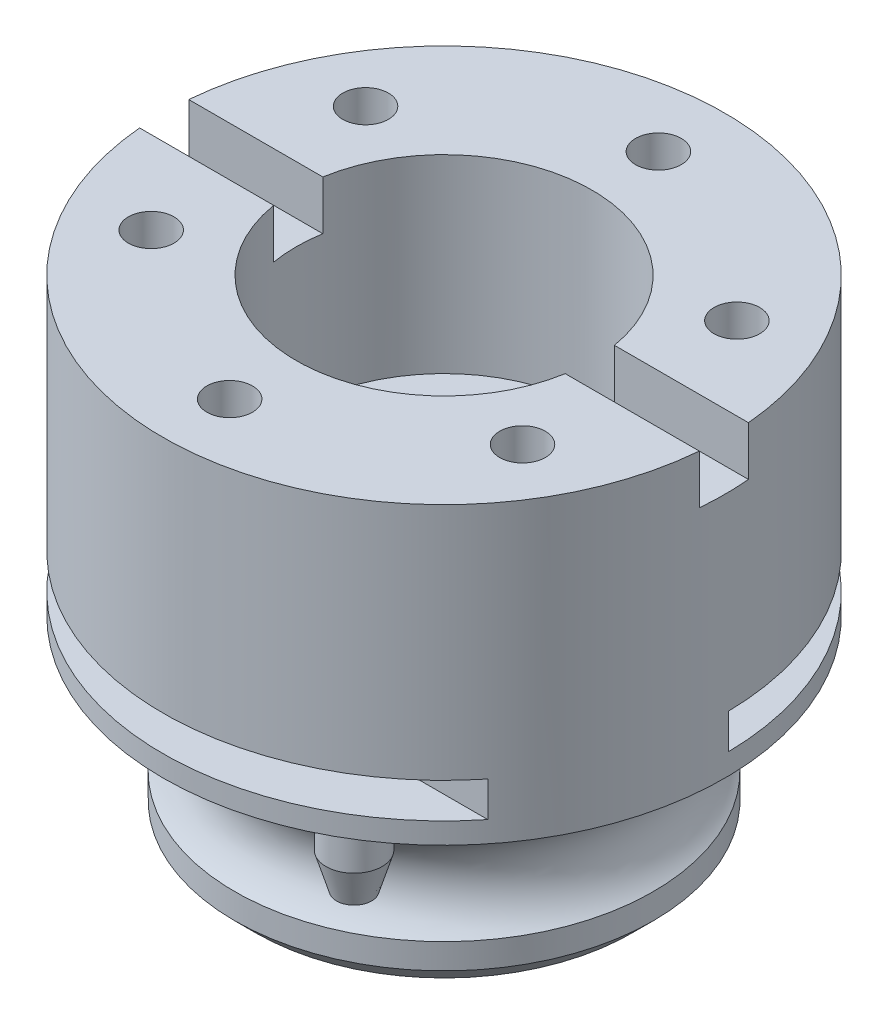
from build123d import *

# Parameters (mm, degrees)
SKETCH1_R                            = 29.8
SKETCH1_R_2                          = 20.2
BOSS_EXTRUDE1_DEPTH                  = 25.7
SKETCH3_R                            = 40
BOSS_EXTRUDE2_DEPTH                  = 15
SKETCH4_R                            = 4
BOSS_EXTRUDE3_DEPTH                  = 5
SKETCH6_R                            = 2.5
CUT_EXTRUDE1_START                   = -12
CUT_EXTRUDE1_DEPTH                   = 5
CUT_EXTRUDE6_DEPTH                   = 3.2
SKETCH15_W                           = 16.44
SKETCH15_H                           = 4.4
CUT_EXTRUDE7_DEPTH                   = 63.132841557
SKETCH16_R                           = 0.8
CUT_EXTRUDE8_DEPTH                   = 64.523302811
CUT_EXTRUDE15_START                  = 40
SKETCH25_R                           = 3.2
CUT_EXTRUDE15_DEPTH                  = 3.5
SKETCH20_R                           = 40
SKETCH20_R_2                         = 21.05
BOSS_EXTRUDE4_DEPTH                  = 27
SKETCH29_R                           = 3.25
BASEPLATE_MOUNTING_HOLES_DEPTH       = 4.825
CUT_EXTRUDE17_REACH                  = 90.223
CUT_EXTRUDE17_END_RADIUS             = 40
SKETCH28_W                           = 7
SKETCH28_H                           = 7
CUT_EXTRUDE17_DIRECTION_2_REACH      = 90.223
CUT_EXTRUDE17_DIRECTION_2_END_RADIUS = 40


with BuildPart() as part:
    # Sketch1 → Boss-Extrude1 (new body)
    with BuildSketch(Plane(origin=(0, 0, 0), x_dir=(1, 0, 0), z_dir=(0, 1, 0))):
        with Locations(Location((0, 0, 0), (0, 0, 90))):
            Circle(SKETCH1_R)
        with Locations(Location((0, 0, 0), (0, 0, 90))):
            Circle(SKETCH1_R_2, mode=Mode.SUBTRACT)
    extrude(amount=BOSS_EXTRUDE1_DEPTH)

    # Sketch2 → Cut-Revolve1 (revolve, cut)
    with BuildSketch(Plane.XY, mode=Mode.PRIVATE) as cut_revolve1_sk:
        with BuildLine():
            Line((29.8, 12.7), (29.8, 18.799180273))
            ThreePointArc((29.8, 18.799180273), (27.590586132, 16.098529094), (26.8, 12.7))
            Line((26.8, 12.7), (29.8, 12.7))
        make_face()
        with BuildLine():
            Line((29.8, 6.600819727), (29.8, 12.7))
            Line((29.8, 12.7), (26.8, 12.7))
            ThreePointArc((26.8, 12.7), (27.590586132, 9.301470906), (29.8, 6.600819727))
        make_face()
        Polygon((29.8, 3), (26.8, 0), (29.8, 0), align=None)
    revolve(cut_revolve1_sk.sketch.rotate(Axis((0, 25.7, 0), (0, -1, 0)), 270), axis=Axis((0, 25.7, 0), (0, -1, 0)), mode=Mode.SUBTRACT)

    # Sketch3 → Boss-Extrude2 (add)
    with BuildSketch(Plane(origin=(0, 25.7, 0), x_dir=(1, 0, 0), z_dir=(0, 1, 0))):
        with Locations(Location((0, 0, 0), (0, 0, 270))):
            Circle(SKETCH3_R)
    extrude(amount=BOSS_EXTRUDE2_DEPTH)

    # Sketch4 → Boss-Extrude3 (add)
    with BuildSketch(Plane(origin=(0, 25.7, 0), x_dir=(-1, 0, 0), z_dir=(0, -1, 0))):
        with Locations(Location((-17.5, -30.310889132, 0), (0, 0, 270))):
            Circle(SKETCH4_R)
        with Locations(Location((32.889241728, -11.970705016, 0), (0, 0, 270))):
            Circle(SKETCH4_R)
        with Locations(Location((-6.077686218, 34.468271355, 0), (0, 0, 270))):
            Circle(SKETCH4_R)
    extrude(amount=BOSS_EXTRUDE3_DEPTH)

    # Sketch6 → section 1 of loft1
    with BuildSketch(Plane(origin=(0, 15.7, 0), x_dir=(-1, 0, 0), z_dir=(0, -1, 0)), mode=Mode.PRIVATE) as loft1_s1:
        with Locations((32.889241728, -11.970705016)):
            Circle(SKETCH6_R)
    # loft from a face of the part (loft1)
    loft([part.faces().sort_by_distance((-32.889241728, 20.7, 11.970705016))[0], loft1_s1.sketch])

    # Boundary1: read off the stored shape, not the designer's step
    # Boundary1 outline → Boundary1 (revolve)
    with BuildSketch(Plane(origin=(17.5, 0, 30.310889132), x_dir=(1, 0, 0), z_dir=(0, 0, 1))):
        Polygon((0, 20.7), (0, 15.7), (2.5, 15.7), (4, 20.7), align=None)
    revolve(axis=Axis((17.5, 0, 30.310889132), (0, 1, 0)))

    # Boundary2: read off the stored shape, not the designer's step
    # Boundary2: loft between two sections, ruled curve by curve
    boundary2_from = [
        Edge.make_bspline([(9.922742778, 20.7, -33.365756026), (9.778423859, 20.7, -32.862439299), (9.289775651, 20.7, -31.913155977), (8.067478825, 20.7, -30.878607721), (6.542374051, 20.7, -30.390384874), (4.946413374, 20.7, -30.522974824), (3.522746317, 20.7, -31.256212676), (2.488002725, 20.7, -32.47846094), (1.999820352, 20.7, -34.003603594), (2.132382571, 20.7, -35.599531113), (2.865650923, 20.7, -37.023214684), (4.087837179, 20.7, -38.057933438), (5.613033755, 20.7, -38.546155237), (7.208931106, 20.7, -38.413575903), (8.632657493, 20.7, -37.680313497), (9.667322676, 20.7, -36.45811299), (10.155689167, 20.7, -34.933056337), (10.067061697, 20.7, -33.869072752), (9.922742778, 20.7, -33.365756026)], [0, 0, 0, 0, 0.0625, 0.125, 0.1875, 0.25, 0.3125, 0.375, 0.4375, 0.5, 0.5625, 0.625, 0.6875, 0.75, 0.8125, 0.875, 0.9375, 1, 1, 1, 1], 3),
    ]
    boundary2_to = [
        Edge.make_bspline([(8.313438837, 15.7, -33.349606871), (8.167005998, 15.7, -33.056947538), (7.757868808, 15.7, -32.529805617), (6.88811309, 15.7, -32.034506513), (5.895137902, 15.7, -31.909602819), (4.929849468, 15.7, -32.174234081), (4.139348951, 15.7, -32.788112293), (3.643935799, 15.7, -33.657748526), (3.519005287, 15.7, -34.650828768), (3.783658552, 15.7, -35.616093907), (4.397524642, 15.7, -36.406629525), (5.26722668, 15.7, -36.902042852), (6.260254151, 15.7, -37.026934051), (7.225507947, 15.7, -36.762316146), (8.016039922, 15.7, -36.14841822), (8.511411727, 15.7, -35.27881634), (8.63646584, 15.7, -34.285761617), (8.459871676, 15.7, -33.642266205), (8.313438837, 15.7, -33.349606871)], [0, 0, 0, 0, 0.0625, 0.125, 0.1875, 0.25, 0.3125, 0.375, 0.4375, 0.5, 0.5625, 0.625, 0.6875, 0.75, 0.8125, 0.875, 0.9375, 1, 1, 1, 1], 3),
    ]
    boundary2 = Solid(Shell([*[Face.make_surface_from_curves(boundary2_from[k], boundary2_to[k]) for k in range(1)], Face(Wire(boundary2_from)), Face(Wire(boundary2_to))]))
    add(boundary2)

    # Sketch7 → Cut-Extrude1 (cut)
    with BuildSketch(Plane(origin=(0, 40.7, 0), x_dir=(1, 0, 0), z_dir=(0, 1, 0)).offset(CUT_EXTRUDE1_START)):
        with BuildLine():
            ThreePointArc((31.224989992, 25), (0, 40), (-31.224989992, 25))
            Line((-31.224989992, 25), (0, 25))
            Line((0, 25), (31.224989992, 25))
        make_face()
        with BuildLine():
            Line((-5.8e-08, -25), (-31.224989992, -25))
            ThreePointArc((-31.224989992, -25), (0, -40), (31.224989992, -25))
            Line((31.224989992, -25), (-5.8e-08, -25))
        make_face()
        with BuildLine():
            Line((-19.515618745, -15.625), (-31.224989992, -25))
            Line((-31.224989992, -25), (-5.8e-08, -25))
            ThreePointArc((-5.8e-08, -25), (-10.825317574, -22.534695459), (-19.515618745, -15.625))
        make_face()
        with BuildLine():
            Line((-24.998227986, -0.297653397), (-39.997164778, -0.476245435))
            ThreePointArc((-39.997164778, -0.476245435), (-37.663011922, -13.472102025), (-31.224989992, -25))
            Line((-31.224989992, -25), (-19.515618745, -15.625))
            ThreePointArc((-19.515618745, -15.625), (-23.539382451, -8.420063766), (-24.998227986, -0.297653397))
        make_face()
        with BuildLine():
            ThreePointArc((39.997164778, 0.476245435), (37.663011922, 13.472102025), (31.224989992, 25))
            Line((31.224989992, 25), (19.515618745, 15.625))
            ThreePointArc((19.515618745, 15.625), (23.539382451, 8.420063766), (24.998227986, 0.297653397))
            Line((24.998227986, 0.297653397), (39.997164778, 0.476245435))
        make_face()
        with BuildLine():
            Line((31.224989992, 25), (0, 25))
            ThreePointArc((0, 25), (10.825317547, 22.534695472), (19.515618745, 15.625))
            Line((19.515618745, 15.625), (31.224989992, 25))
        make_face()
    extrude(amount=CUT_EXTRUDE1_DEPTH, mode=Mode.SUBTRACT)

    # Sketch14 → Cut-Extrude6 (cut)
    with BuildSketch(Plane(origin=(0, 25.7, 0), x_dir=(-1, 0, 0), z_dir=(0, -1, 0))):
        with BuildLine():
            Line((10.22, -2.2), (-10.22, -2.2))
            ThreePointArc((-10.22, -2.2), (-12.42, 0), (-10.22, 2.2))
            Line((-10.22, 2.2), (10.22, 2.2))
            ThreePointArc((10.22, 2.2), (12.42, 0), (10.22, -2.2))
        make_face()
        with BuildLine():
            Line((10.22, 10.2), (-10.22, 10.2))
            ThreePointArc((-10.22, 10.2), (-12.42, 8), (-10.22, 5.8))
            Line((-10.22, 5.8), (10.22, 5.8))
            ThreePointArc((10.22, 5.8), (12.42, 8), (10.22, 10.2))
        make_face()
        with BuildLine():
            Line((10.22, -5.8), (-10.22, -5.8))
            ThreePointArc((-10.22, -5.8), (-12.42, -8), (-10.22, -10.2))
            Line((-10.22, -10.2), (10.22, -10.2))
            ThreePointArc((10.22, -10.2), (12.42, -8), (10.22, -5.8))
        make_face()
    extrude(amount=-CUT_EXTRUDE6_DEPTH, mode=Mode.SUBTRACT)

    # Sketch15 → Cut-Extrude7 (cut, through all)
    with BuildSketch(Plane(origin=(0, 25.7, 0), x_dir=(-1, 0, 0), z_dir=(0, -1, 0))):
        Rectangle(SKETCH15_W, SKETCH15_H)
        with Locations((0, -8)):
            Rectangle(SKETCH15_W, SKETCH15_H)
        with Locations((0, 8)):
            Rectangle(SKETCH15_W, SKETCH15_H)
    extrude(amount=-CUT_EXTRUDE7_DEPTH, mode=Mode.SUBTRACT)

    # Sketch16 → Cut-Extrude8 (cut, through all)
    with BuildSketch(Plane(origin=(0, 28.9, 0), x_dir=(-1, 0, 0), z_dir=(0, -1, 0))):
        with Locations(Location((-10.22, -8, 0), (0, 0, 90))):
            Circle(SKETCH16_R)
        with Locations(Location((-10.22, 0, 0), (0, 0, 90))):
            Circle(SKETCH16_R)
        with Locations(Location((-10.22, 8, 0), (0, 0, 90))):
            Circle(SKETCH16_R)
        with Locations(Location((10.22, -8, 0), (0, 0, 90))):
            Circle(SKETCH16_R)
        with Locations(Location((10.22, 0, 0), (0, 0, 90))):
            Circle(SKETCH16_R)
        with Locations(Location((10.22, 8, 0), (0, 0, 90))):
            Circle(SKETCH16_R)
    extrude(amount=-CUT_EXTRUDE8_DEPTH, mode=Mode.SUBTRACT)

    # Sketch25 → Cut-Extrude15 (cut)
    with BuildSketch(Plane(origin=(0, 0, 0), x_dir=(0, -1, 0), z_dir=(-0.9455185755993166, 0, -0.32556815445715737)).offset(CUT_EXTRUDE15_START)):
        with Locations(Location((-31.2, 0, 0), (0, 0, 90))):
            Circle(SKETCH25_R)
    extrude(amount=-CUT_EXTRUDE15_DEPTH, mode=Mode.SUBTRACT)

    # Sketch20 → Boss-Extrude4 (add)
    with BuildSketch(Plane(origin=(0, 40.7, 0), x_dir=(1, 0, 0), z_dir=(0, 1, 0))):
        with Locations(Location((0, 0, 0), (0, 0, 270))):
            Circle(SKETCH20_R)
        with Locations(Location((0, 0, 0), (0, 0, 270))):
            Circle(SKETCH20_R_2, mode=Mode.SUBTRACT)
    extrude(amount=BOSS_EXTRUDE4_DEPTH)

    # Sketch29 → baseplate mounting holes (cut)
    with BuildSketch(Plane(origin=(0, 67.7, 0), x_dir=(1, 0, 0), z_dir=(0, 1, 0))):
        with Locations(Location((0, -30.525, 0), (0, 0, 270))):
            Circle(SKETCH29_R)
        with Locations(Location((-26.435425451, -15.2625, 0), (0, 0, 270))):
            Circle(SKETCH29_R)
        with Locations(Location((-26.435425451, 15.2625, 0), (0, 0, 270))):
            Circle(SKETCH29_R)
        with Locations(Location((0, 30.525, 0), (0, 0, 270))):
            Circle(SKETCH29_R)
        with Locations(Location((26.435425451, 15.2625, 0), (0, 0, 270))):
            Circle(SKETCH29_R)
        with Locations(Location((26.435425451, -15.2625, 0), (0, 0, 270))):
            Circle(SKETCH29_R)
    extrude(amount=-BASEPLATE_MOUNTING_HOLES_DEPTH, mode=Mode.SUBTRACT)

    # Cut-Extrude17: up to this cylinder (the profile starts inside it)
    cut_extrude17_end = Plane(origin=(0, 64.2, 0), z_dir=(0, -1, 0)) * Cylinder(CUT_EXTRUDE17_END_RADIUS, 261.446, mode=Mode.PRIVATE)
    # Sketch28 → Cut-Extrude17 (cut, up to the surface)
    with BuildSketch(Plane(origin=(0, 0, 0), x_dir=(0, 0, -1), z_dir=(1, 0, 0)), mode=Mode.PRIVATE) as cut_extrude17_sk1:
        with Locations((0, 64.2)):
            Rectangle(SKETCH28_W, SKETCH28_H)
    cut_extrude17_tool1 = extrude(cut_extrude17_sk1.sketch, amount=-CUT_EXTRUDE17_REACH, mode=Mode.PRIVATE) & cut_extrude17_end
    add(cut_extrude17_tool1.solids().sort_by_distance((0, 64.2, 0))[0], mode=Mode.SUBTRACT)

    # Cut-Extrude17 direction 2: up to this cylinder (the profile starts inside it)
    cut_extrude17_direction_2_end = Plane(origin=(0, 64.2, 0), z_dir=(0, -1, 0)) * Cylinder(CUT_EXTRUDE17_DIRECTION_2_END_RADIUS, 261.446, mode=Mode.PRIVATE)
    # Sketch28 → Cut-Extrude17 direction 2 (cut, up to the surface)
    with BuildSketch(Plane(origin=(0, 0, 0), x_dir=(0, 0, -1), z_dir=(1, 0, 0)), mode=Mode.PRIVATE) as cut_extrude17_direction_2_sk1:
        with Locations((0, 64.2)):
            Rectangle(SKETCH28_W, SKETCH28_H)
    cut_extrude17_direction_2_tool1 = extrude(cut_extrude17_direction_2_sk1.sketch, amount=CUT_EXTRUDE17_DIRECTION_2_REACH, mode=Mode.PRIVATE) & cut_extrude17_direction_2_end
    add(cut_extrude17_direction_2_tool1.solids().sort_by_distance((0, 64.2, 0))[0], mode=Mode.SUBTRACT)


solid = part.part
